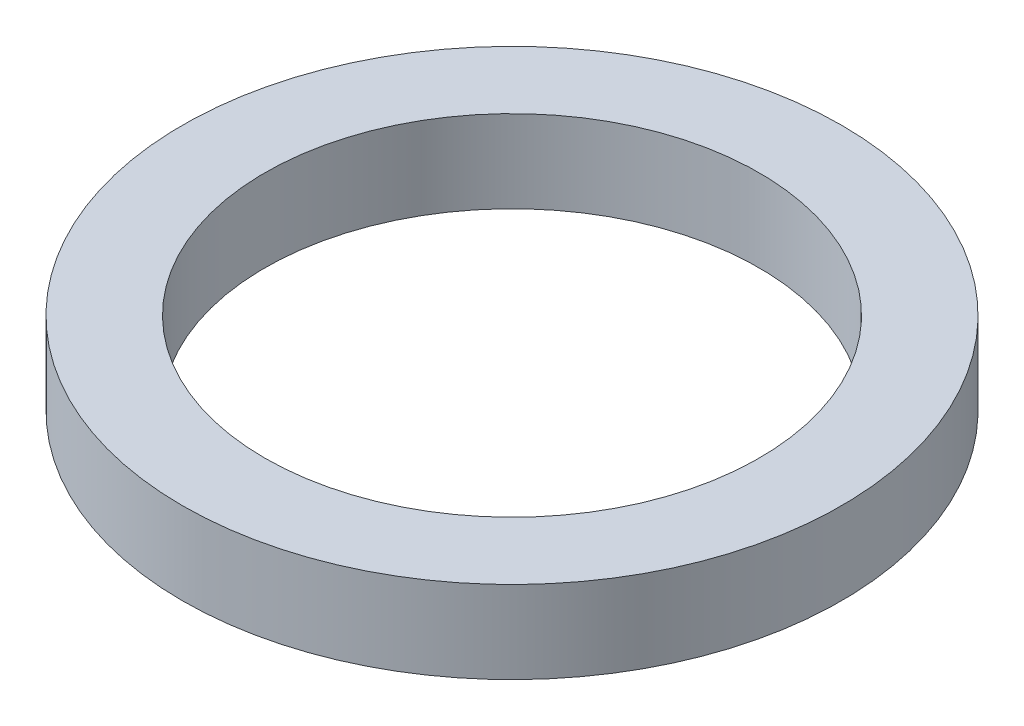
from build123d import *

# Parameters (mm, degrees)
SKETCH1_R           = 16
SKETCH1_R_2         = 12
BOSS_EXTRUDE1_DEPTH = 4


with BuildPart() as part:
    # Sketch1 → Boss-Extrude1 (new body)
    with BuildSketch(Plane(origin=(0, 0, 0), x_dir=(1, 0, 0), z_dir=(0, 1, 0))):
        Circle(SKETCH1_R)
        Circle(SKETCH1_R_2, mode=Mode.SUBTRACT)
    extrude(amount=BOSS_EXTRUDE1_DEPTH)


solid = part.part
